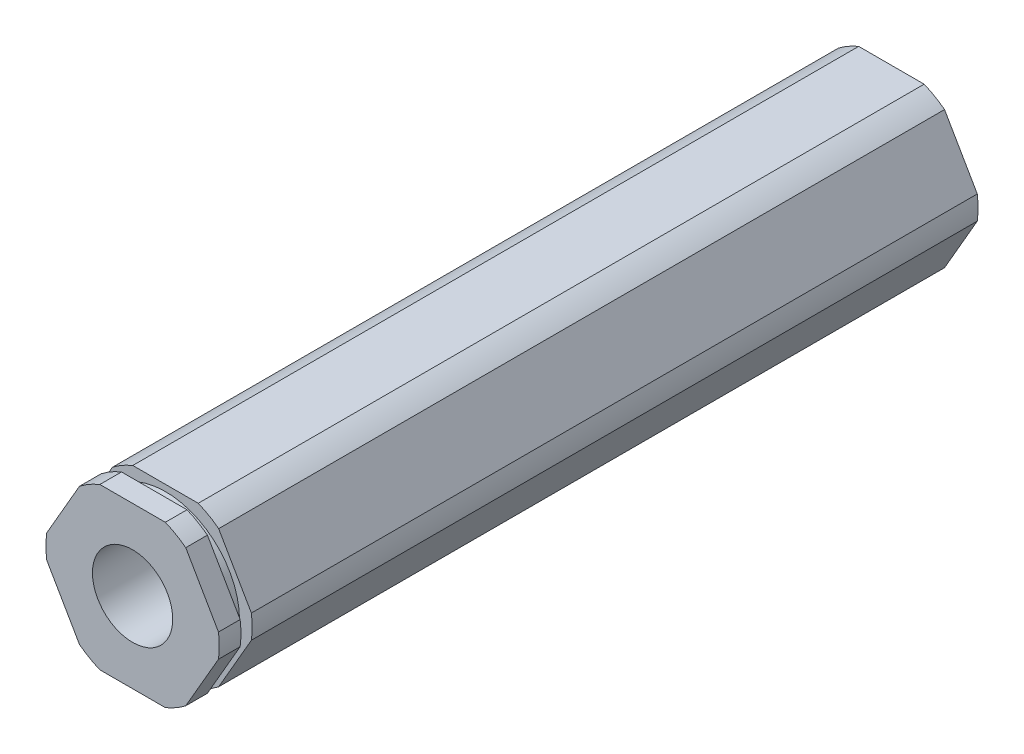
from build123d import *

# Parameters (mm, degrees)
SKETCH1_R           = 3.175
BOSS_EXTRUDE1_DEPTH = 30.01518
SKETCH2_W           = 0.889
SKETCH2_H           = 1.0033


with BuildPart() as part:
    # Sketch1 → Boss-Extrude1 (new, symmetric)
    with BuildSketch(Plane.XY):
        with BuildLine():
            ThreePointArc((4.204110358, 5.41826726), (3.429, 5.939202219), (2.590301913, 6.35))
            Line((2.590301913, 6.35), (-2.590301913, 6.35))
            ThreePointArc((-2.590301913, 6.35), (-3.429, 5.939202219), (-4.204110358, 5.41826726))
            Line((-4.204110358, 5.41826726), (-6.79441227, 0.93173274))
            ThreePointArc((-6.79441227, 0.93173274), (-6.858, 0), (-6.79441227, -0.93173274))
            Line((-6.79441227, -0.93173274), (-4.204110358, -5.41826726))
            ThreePointArc((-4.204110358, -5.41826726), (-3.429, -5.939202219), (-2.590301913, -6.35))
            Line((-2.590301913, -6.35), (2.590301913, -6.35))
            ThreePointArc((2.590301913, -6.35), (3.429, -5.939202219), (4.204110358, -5.41826726))
            Line((4.204110358, -5.41826726), (6.79441227, -0.93173274))
            ThreePointArc((6.79441227, -0.93173274), (6.8420846, -0.466950024), (6.858, 0))
            ThreePointArc((6.858, 0), (6.8420846, 0.466950024), (6.79441227, 0.93173274))
            Line((6.79441227, 0.93173274), (4.204110358, 5.41826726))
        make_face()
        Circle(SKETCH1_R, mode=Mode.SUBTRACT)
    extrude(amount=BOSS_EXTRUDE1_DEPTH, both=True)

    # Sketch2 → Cut-Revolve1 (revolve, cut)
    with BuildSketch(Plane(origin=(0, 0, 0), x_dir=(0, 0, -1), z_dir=(1, 0, 0))):
        with Locations((-27.85618, 6.35635)):
            Rectangle(SKETCH2_W, SKETCH2_H)
    revolve(axis=Axis((0, 0, 2.405637885), (0, 0, -1)), mode=Mode.SUBTRACT)


solid = part.part
